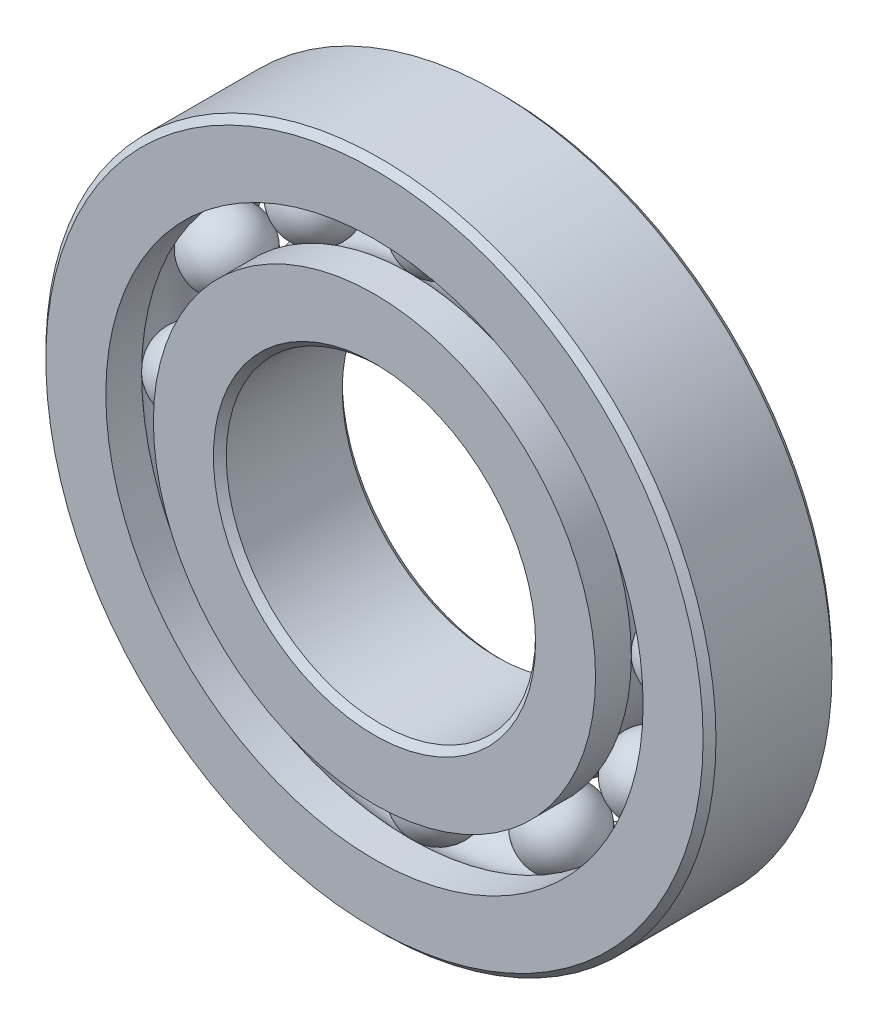
from build123d import *

# Parameters (mm, degrees)
CIRPATTERN1_COUNT = 12


with BuildPart() as part:
    # Sketch1 → Revolve1 (revolve)
    with BuildSketch(Plane(origin=(0, 0, 0), x_dir=(0, 0, -1), z_dir=(1, 0, 0))):
        with BuildLine():
            Line((3.571875, 20.6375), (-3.571875, 20.6375))
            Line((-3.571875, 20.6375), (-3.96875, 20.240625))
            Line((-3.96875, 20.240625), (-3.96875, 16.546634615))
            Line((-3.96875, 16.546634615), (-1.763888889, 16.546634615))
            ThreePointArc((-1.763888889, 16.546634615), (0, 17.374425982), (1.763888889, 16.546634615))
            Line((1.763888889, 16.546634615), (3.96875, 16.546634615))
            Line((3.96875, 16.546634615), (3.96875, 20.240625))
            Line((3.96875, 20.240625), (3.571875, 20.6375))
        make_face()
    revolve(axis=Axis((0, 0, 3.96875), (0, 0, -1)))


with BuildPart() as body_2:
    # Sketch3 → Revolve3 (revolve)
    with BuildSketch(Plane(origin=(0, 0, 0), x_dir=(0, 0, -1), z_dir=(1, 0, 0))):
        with BuildLine():
            Line((-3.96875, 13.615865385), (-1.763888889, 13.615865385))
            ThreePointArc((-1.763888889, 13.615865385), (0, 12.788074018), (1.763888889, 13.615865385))
            Line((1.763888889, 13.615865385), (3.96875, 13.615865385))
            Line((3.96875, 13.615865385), (3.96875, 9.921875))
            Line((3.96875, 9.921875), (3.571875, 9.525))
            Line((3.571875, 9.525), (-3.571875, 9.525))
            Line((-3.571875, 9.525), (-3.96875, 9.921875))
            Line((-3.96875, 9.921875), (-3.96875, 13.615865385))
        make_face()
    revolve(axis=Axis((0, 0, 3.96875), (0, 0, -1)))


with BuildPart() as body_3:
    # Sketch4 → Revolve4 (revolve)
    with BuildSketch(Plane(origin=(0, 0, 0), x_dir=(0, 0, -1), z_dir=(1, 0, 0))):
        with BuildLine():
            Line((-2.293175982, 15.08125), (2.293175982, 15.08125))
            ThreePointArc((2.293175982, 15.08125), (0, 17.374425982), (-2.293175982, 15.08125))
        make_face()
    revolve(axis=Axis((0, 15.08125, 2.293175982), (0, 0, -1)))


with BuildPart() as cirpattern1_1:
    # CirPattern1: pattern copy
    add(body_3.part.rotate(Axis((0, 0, -3.96875), (0, 0, 1)), 1 * 360 / CIRPATTERN1_COUNT))


with BuildPart() as cirpattern1_2:
    # CirPattern1: pattern copy
    add(body_3.part.rotate(Axis((0, 0, -3.96875), (0, 0, 1)), 2 * 360 / CIRPATTERN1_COUNT))


with BuildPart() as cirpattern1_3:
    # CirPattern1: pattern copy
    add(body_3.part.rotate(Axis((0, 0, -3.96875), (0, 0, 1)), 3 * 360 / CIRPATTERN1_COUNT))


with BuildPart() as cirpattern1_4:
    # CirPattern1: pattern copy
    add(body_3.part.rotate(Axis((0, 0, -3.96875), (0, 0, 1)), 4 * 360 / CIRPATTERN1_COUNT))


with BuildPart() as cirpattern1_5:
    # CirPattern1: pattern copy
    add(body_3.part.rotate(Axis((0, 0, -3.96875), (0, 0, 1)), 5 * 360 / CIRPATTERN1_COUNT))


with BuildPart() as cirpattern1_6:
    # CirPattern1: pattern copy
    add(body_3.part.rotate(Axis((0, 0, -3.96875), (0, 0, 1)), 6 * 360 / CIRPATTERN1_COUNT))


with BuildPart() as cirpattern1_7:
    # CirPattern1: pattern copy
    add(body_3.part.rotate(Axis((0, 0, -3.96875), (0, 0, 1)), 7 * 360 / CIRPATTERN1_COUNT))


with BuildPart() as cirpattern1_8:
    # CirPattern1: pattern copy
    add(body_3.part.rotate(Axis((0, 0, -3.96875), (0, 0, 1)), 8 * 360 / CIRPATTERN1_COUNT))


with BuildPart() as cirpattern1_9:
    # CirPattern1: pattern copy
    add(body_3.part.rotate(Axis((0, 0, -3.96875), (0, 0, 1)), 9 * 360 / CIRPATTERN1_COUNT))


with BuildPart() as cirpattern1_10:
    # CirPattern1: pattern copy
    add(body_3.part.rotate(Axis((0, 0, -3.96875), (0, 0, 1)), 10 * 360 / CIRPATTERN1_COUNT))


with BuildPart() as cirpattern1_11:
    # CirPattern1: pattern copy
    add(body_3.part.rotate(Axis((0, 0, -3.96875), (0, 0, 1)), 11 * 360 / CIRPATTERN1_COUNT))


solid = Compound([part.part, body_2.part, body_3.part, cirpattern1_1.part, cirpattern1_2.part, cirpattern1_3.part, cirpattern1_4.part, cirpattern1_5.part, cirpattern1_6.part, cirpattern1_7.part, cirpattern1_8.part, cirpattern1_9.part, cirpattern1_10.part, cirpattern1_11.part])
